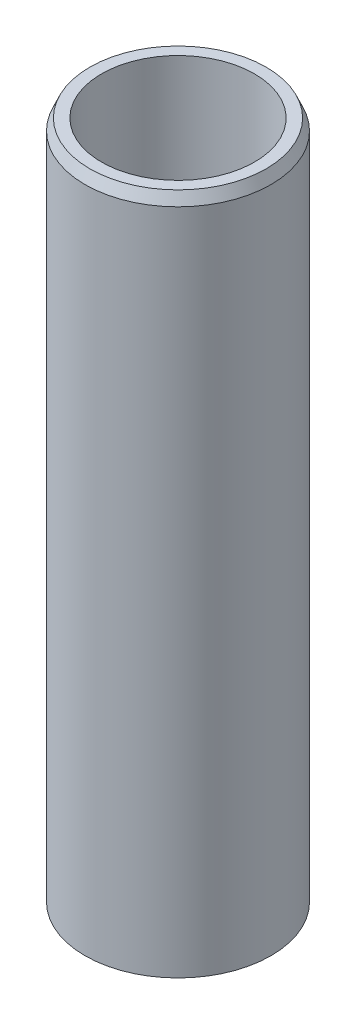
from build123d import *
from OCP.BRepFilletAPI import BRepFilletAPI_MakeChamfer

# Parameters (mm, degrees)
SKETCH1_R           = 40
BOSS_EXTRUDE1_DEPTH = 294.174973671
SKETCH2_R           = 32.899828072
CUT_EXTRUDE1_DEPTH  = 300.564542519
CHAMFER1_SIZE       = 4.826576022
CHAMFER1_SIZE2      = 2.094442698


with BuildPart() as part:
    # Sketch1 → Boss-Extrude1 (new body)
    with BuildSketch(Plane(origin=(0, 0, 0), x_dir=(1, 0, 0), z_dir=(0, 1, 0))):
        Circle(SKETCH1_R)
    extrude(amount=BOSS_EXTRUDE1_DEPTH)

    # Sketch2 → Cut-Extrude1 (cut, through all)
    with BuildSketch(Plane(origin=(0, 0, 0), x_dir=(1, 0, 0), z_dir=(0, 1, 0))):
        Circle(SKETCH2_R)
    extrude(amount=CUT_EXTRUDE1_DEPTH, mode=Mode.SUBTRACT)

    # Chamfer1: one chamfer whose edges measure the first distance from different faces: ONE call of the kernel's chamfer builder (chamfer() names one face for all edges)
    chamfer1_edges_1 = [part.edges().sort_by_distance(p)[0] for p in [
        (-40, 294.174973671, 0),
    ]]
    chamfer1_side_1 = [part.faces().sort_by_distance(p)[0] for p in [
        (-40, 147.087486836, 0),
    ]]
    chamfer1_edges_2 = [part.edges().sort_by_distance(p)[0] for p in [
        (-40, 0, 0),
    ]]
    chamfer1_side_2 = [part.faces().sort_by_distance(p)[0] for p in [
        (-38.86862915, 0, 0),
    ]]
    chamfer1 = BRepFilletAPI_MakeChamfer(part.part.solid().wrapped)
    for e in chamfer1_edges_1:
        chamfer1.Add(CHAMFER1_SIZE, CHAMFER1_SIZE2, e.wrapped, chamfer1_side_1[0].wrapped)  # the first distance lies on this face
    for e in chamfer1_edges_2:
        chamfer1.Add(CHAMFER1_SIZE, CHAMFER1_SIZE2, e.wrapped, chamfer1_side_2[0].wrapped)  # the first distance lies on this face
    add(Compound.cast(chamfer1.Shape()), mode=Mode.REPLACE)


solid = part.part
